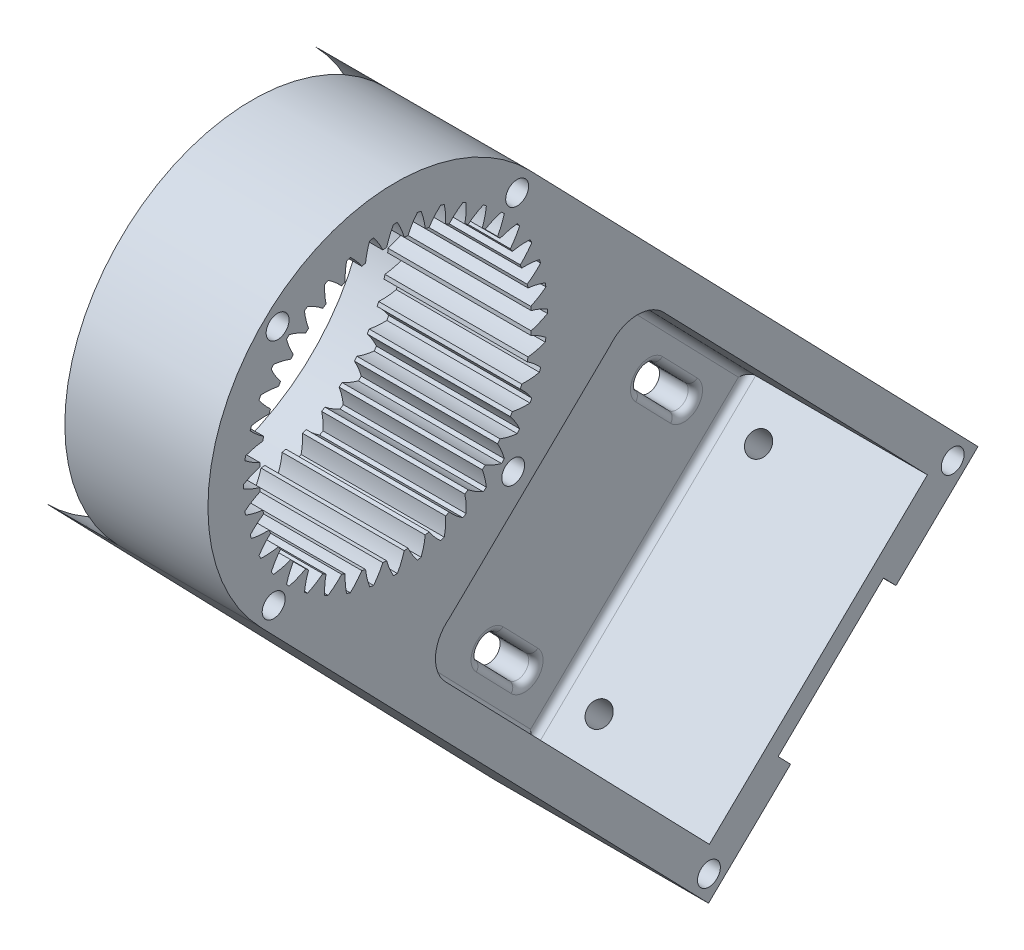
from build123d import *

# Parameters (mm, degrees)
BASPROSKE_W         = 30
BASPROSKE_H         = 7.2
TOOTHCUT_DEPTH      = 48.674731253
TEETHCUTS_COUNT     = 40
TEETHCUTS_ANGLE     = 351
BOSS_EXTRUDE1_START = -30
BOSS_EXTRUDE1_DEPTH = 30
BOSS_EXTRUDE2_START = -5
BOSS_EXTRUDE2_DEPTH = 5
CUT_EXTRUDE2_START  = -10
SKETCH5_R           = 26.2
CUT_EXTRUDE2_DEPTH  = 10
BOSS_EXTRUDE3_START = 25
BOSS_EXTRUDE3_DEPTH = 25
CUT_EXTRUDE3_DEPTH  = 25
FILLET1_R           = 5
CUT_EXTRUDE4_DEPTH  = 120.999510638
SKETCH9_R           = 1
CUT_EXTRUDE5_DEPTH  = 2
SKETCH11_R          = 1.6
CUT_EXTRUDE7_DEPTH  = 120.999510638
FILLET2_R           = 1
SKETCH1_R           = 1.6
CUT_EXTRUDE1_DEPTH  = 120.999510638
SKETCH12_R          = 1.6
CUT_EXTRUDE8_DEPTH  = 10
CUT_EXTRUDE9_DEPTH  = 119.848149137


with BuildPart() as part:
    # BasProSke → Base-Revolve (revolve)
    with BuildSketch(Plane(origin=(0, 0, 0), x_dir=(1, 0, 0), z_dir=(0, 1, 0)), mode=Mode.PRIVATE) as base_revolve_sk:
        with Locations((15, 22.6)):
            Rectangle(BASPROSKE_W, BASPROSKE_H)
    revolve(base_revolve_sk.sketch.rotate(Axis((-10, 0, 0), (1, 0, 0)), 180), axis=Axis((-10, 0, 0), (1, 0, 0)))

    # TooCutSke → ToothCut (cut, through all)
    with BuildSketch(Plane(origin=(0, 0, 0), x_dir=(0, 0, -1), z_dir=(1, 0, 0))):
        with BuildLine():
            ThreePointArc((1.228324582, 18.934800339), (0.823024268, 20.12207302), (0.272257981, 21.249255907))
            ThreePointArc((0.272257981, 21.249255907), (0, 21.251), (-0.272257981, 21.249255907))
            ThreePointArc((-0.272257981, 21.249255907), (-0.823024268, 20.12207302), (-1.228324582, 18.934800339))
            ThreePointArc((-1.228324582, 18.934800339), (0, 18.9746), (1.228324582, 18.934800339))
        make_face()
    toothcut = extrude(amount=TOOTHCUT_DEPTH, mode=Mode.SUBTRACT)

    # TeethCuts: ToothCut ×40 about axis
    teethcuts_axis = Axis((-10, 0, 0), (1, 0, 0))
    for i in range(1, TEETHCUTS_COUNT):
        add(toothcut.rotate(teethcuts_axis, i * TEETHCUTS_ANGLE / (TEETHCUTS_COUNT - 1)), mode=Mode.SUBTRACT)

    # Sketch3 → Boss-Extrude1 (add)
    with BuildSketch(Plane.ZY.offset(BOSS_EXTRUDE1_START)):
        with BuildLine():
            Line((-43.870748258, -75.827418835), (4.530431082, -25.80533267))
            ThreePointArc((4.530431082, -25.80533267), (12.28016055, -23.143847063), (18.828747548, -18.218624146))
            Line((18.828747548, -18.218624146), (-43.754312495, -82.897527937))
            Line((-43.754312495, -82.897527937), (-55.216851555, -71.806418963))
            Line((-55.216851555, -71.806418963), (-53.478433221, -70.009782747))
            Line((-53.478433221, -70.009782747), (-68.210850196, -55.754752404))
            Line((-68.210850196, -55.754752404), (-69.94926853, -57.55138862))
            Line((-69.94926853, -57.55138862), (-81.411807591, -46.460279646))
            Line((-81.411807591, -46.460279646), (-18.828747548, 18.218624146))
            ThreePointArc((-18.828747548, 18.218624146), (-23.535664136, 11.51140798), (-25.940519149, 3.678242283))
            Line((-25.940519149, 3.678242283), (-74.341698489, -46.343843882))
            Line((-74.341698489, -46.343843882), (-43.870748258, -75.827418835))
        make_face()
    extrude(amount=BOSS_EXTRUDE1_DEPTH)

    # Sketch4 → Boss-Extrude2 (add)
    with BuildSketch(Plane.ZY.offset(BOSS_EXTRUDE2_START)):
        with BuildLine():
            Line((4.530431082, -25.80533267), (-43.870748258, -75.827418835))
            Line((-43.870748258, -75.827418835), (-74.341698489, -46.343843882))
            Line((-74.341698489, -46.343843882), (-25.940519149, 3.678242283))
            ThreePointArc((-25.940519149, 3.678242283), (-18.218624146, -18.828747548), (4.530431082, -25.80533267))
        make_face()
    extrude(amount=BOSS_EXTRUDE2_DEPTH)

    # Sketch5 → Cut-Extrude2 (cut)
    with BuildSketch(Plane.ZY.offset(CUT_EXTRUDE2_START)):
        Circle(SKETCH5_R)
    extrude(amount=CUT_EXTRUDE2_DEPTH, mode=Mode.SUBTRACT)

    # Sketch6 → Boss-Extrude3 (add)
    with BuildSketch(Plane(origin=(5, 0, 0), x_dir=(0, 0, -1), z_dir=(1, 0, 0)).offset(BOSS_EXTRUDE3_START)):
        with BuildLine():
            Line((25.940519149, 3.678242283), (31.153160938, -1.708965638))
            ThreePointArc((31.153160938, -1.708965638), (21.695460815, -22.422019981), (0.682210708, -31.192540591))
            Line((0.682210708, -31.192540591), (-4.530431082, -25.80533267))
            ThreePointArc((-4.530431082, -25.80533267), (18.218624146, -18.828747548), (25.940519149, 3.678242283))
        make_face()
    extrude(amount=-BOSS_EXTRUDE3_DEPTH)

    # Sketch7 → Cut-Extrude3 (cut)
    with BuildSketch(Plane(origin=(30, 0, 0), x_dir=(0, 0, -1), z_dir=(1, 0, 0))):
        with BuildLine():
            Line((7.552294735, -30.272146343), (30.007043961, -8.545016836))
            ThreePointArc((30.007043961, -8.545016836), (21.695460815, -22.422019981), (7.552294735, -30.272146343))
        make_face()
    extrude(amount=-CUT_EXTRUDE3_DEPTH, mode=Mode.SUBTRACT)

    # Fillet1
    # the kernel refuses this fillet: 5 mm, written as the material it adds along each edge
    with BuildSketch(Plane(origin=(30, -1.708965638, -31.153160938), x_dir=(0, -0.7186544865731284, -0.6953673338087671), z_dir=(-1, 0, 0))) as fillet1_piece_1:
        with BuildLine():
            CenterArc((9.082355484, 5), FILLET1_R, 173.370663496, 96.629336504)
            Line((4.115786557, 5.577228804), (4.016455179, 5.58877338))
            ThreePointArc((4.016455179, 5.58877338), (2.132792747, 2.733341392), (-0.073368738, 0.067948718))
            Line((-0.073368738, 0.067948718), (0, -0.1))
            Line((0, -0.1), (9.082355484, -0.1))
            Line((9.082355484, -0.1), (9.082355484, 0))
        make_face()
    extrude(amount=25)
    with BuildSketch(Plane(origin=(30, -31.192540591, -0.682210708), x_dir=(0, -0.7186544865731269, -0.6953673338087686), z_dir=(-1, 0, 0))) as fillet1_piece_2:
        with BuildLine():
            CenterArc((9.082355484, -5), FILLET1_R, 90, 96.629336504)
            Line((4.115786557, -5.577228804), (4.016455179, -5.58877338))
            ThreePointArc((4.016455179, -5.58877338), (2.132792747, -2.733341392), (-0.073368738, -0.067948718))
            Line((-0.073368738, -0.067948718), (0, 0.1))
            Line((0, 0.1), (9.082355484, 0.1))
            Line((9.082355484, 0.1), (9.082355484, 0))
        make_face()
    extrude(amount=25)

    # Sketch8 → Cut-Extrude4 (cut, through all)
    with BuildSketch(Plane.ZY):
        with BuildLine():
            Line((-15.460756154, -40.713649318), (-20.32832749, -45.744230724))
            ThreePointArc((-20.32832749, -45.744230724), (-22.590762403, -45.781490168), (-22.628021847, -43.519055256))
            Line((-22.628021847, -43.519055256), (-17.760450511, -38.488473849))
            ThreePointArc((-17.760450511, -38.488473849), (-15.498015598, -38.451214405), (-15.460756154, -40.713649318))
        make_face()
        with BuildLine():
            Line((-40.038739594, -16.932086501), (-44.906310931, -21.962667907))
            ThreePointArc((-44.906310931, -21.962667907), (-44.869051487, -24.22510282), (-42.606616574, -24.187843376))
            Line((-42.606616574, -24.187843376), (-37.739045237, -19.15726197))
            ThreePointArc((-37.739045237, -19.15726197), (-37.776304682, -16.894827057), (-40.038739594, -16.932086501))
        make_face()
        with BuildLine():
            Line((-66.462698279, -44.240956991), (-61.595126943, -39.210375585))
            ThreePointArc((-61.595126943, -39.210375585), (-59.33269203, -39.173116141), (-59.295432586, -41.435551053))
            Line((-59.295432586, -41.435551053), (-64.163003922, -46.466132459))
            ThreePointArc((-64.163003922, -46.466132459), (-66.425438835, -46.503391904), (-66.462698279, -44.240956991))
        make_face()
        with BuildLine():
            Line((-41.884714838, -68.022519807), (-37.017143502, -62.991938401))
            ThreePointArc((-37.017143502, -62.991938401), (-37.054402946, -60.729503489), (-39.316837859, -60.766762933))
            Line((-39.316837859, -60.766762933), (-44.184409195, -65.797344339))
            ThreePointArc((-44.184409195, -65.797344339), (-44.147149751, -68.059779252), (-41.884714838, -68.022519807))
        make_face()
    extrude(amount=-CUT_EXTRUDE4_DEPTH, mode=Mode.SUBTRACT)

    # Sketch9 → Cut-Extrude5 (cut)
    with BuildSketch(Plane.ZY):
        with Locations((-60.586073704, -29.247549279)):
            Circle(SKETCH9_R)
        with Locations((-51.275119812, -31.133321699)):
            Circle(SKETCH9_R)
    extrude(amount=-CUT_EXTRUDE5_DEPTH, mode=Mode.SUBTRACT)

    # Sketch11 → Cut-Extrude7 (cut, through all)
    with BuildSketch(Plane(origin=(30, 0, 0), x_dir=(0, 0, -1), z_dir=(1, 0, 0))):
        with Locations((43.812530376, -79.362473386)):
            Circle(SKETCH11_R)
        with Locations((77.87675304, -46.402061764)):
            Circle(SKETCH11_R)
    extrude(amount=-CUT_EXTRUDE7_DEPTH, mode=Mode.SUBTRACT)

    # Fillet2
    fillet2_edges = [part.edges().sort_by_distance(p)[0] for p in [
        (5, -19.40858159, -18.779669348),
        (5, -27.289942519, -55.905216373),
        (5, -33.871525807, -5.604858434),
        (5, -6.717158932, -33.66859775),
        (5, -38.451214405, -15.498015598),
        (5, -43.228940021, -17.894541822),
        (5, -45.781490168, -22.590762403),
        (5, -41.003764553, -20.194236179),
        (5, -16.894827057, -37.776304682),
        (5, -21.672552673, -40.172830906),
        (5, -24.22510282, -44.869051487),
        (5, -19.447377204, -42.472525263),
        (5, -46.503391904, -66.425438835),
        (5, -41.725666288, -64.028912611),
        (5, -39.173116141, -59.33269203),
        (5, -43.950841756, -61.729218254),
        (5, -68.059779252, -44.147149751),
        (5, -63.282053636, -41.750623527),
        (5, -60.729503489, -37.054402946),
        (5, -65.507229104, -39.45092917),
        (5, -61.085631359, -59.106223374),
        (5, -56.773517472, -25.434266142),
    ]]
    fillet(fillet2_edges, radius=FILLET2_R)

    # Sketch1 → Cut-Extrude1 (cut, through all)
    with BuildSketch(Plane(origin=(30, 0, 0), x_dir=(0, 0, -1), z_dir=(1, 0, 0))):
        with Locations((16.461094787, -17.012360299)):
            Circle(SKETCH1_R)
        with Locations((-17.012360299, -16.461094787)):
            Circle(SKETCH1_R)
        with Locations((-16.461094787, 17.012360299)):
            Circle(SKETCH1_R)
        with Locations((17.012360299, 16.461094787)):
            Circle(SKETCH1_R)
    extrude(amount=-CUT_EXTRUDE1_DEPTH, mode=Mode.SUBTRACT)

    # Sketch12 → Cut-Extrude8 (cut)
    with BuildSketch(Plane(origin=(0, -64.678903792, -62.583060043), x_dir=(1, 0, 0), z_dir=(0, -0.7186544865731439, -0.6953673338087512))):
        with Locations(Location((10.5, 15.5, 0), (0, 0, 270))):
            Circle(SKETCH12_R)
        with Locations(Location((10.5, -15.5, 0), (0, 0, 270))):
            Circle(SKETCH12_R)
    extrude(amount=-CUT_EXTRUDE8_DEPTH, mode=Mode.SUBTRACT)

    # Sketch13 → Cut-Extrude9 (cut, through all)
    with BuildSketch(Plane(origin=(5, 0, 0), x_dir=(0, 0, -1), z_dir=(1, 0, 0))):
        with BuildLine():
            Line((19.84175768, -27.822998996), (17.761275763, -25.661611712))
            ThreePointArc((17.761275763, -25.661611712), (17.481920032, -24.949048161), (17.788244219, -24.247655311))
            Line((17.788244219, -24.247655311), (23.551943644, -18.699703533))
            ThreePointArc((23.551943644, -18.699703533), (24.264507194, -18.420347802), (24.965900044, -18.726671988))
            Line((24.965900044, -18.726671988), (27.046381961, -20.888059273))
            ThreePointArc((27.046381961, -20.888059273), (27.325737692, -21.600622823), (27.019413505, -22.302015673))
            Line((27.019413505, -22.302015673), (21.25571408, -27.849967452))
            ThreePointArc((21.25571408, -27.849967452), (20.54315053, -28.129323183), (19.84175768, -27.822998996))
        make_face()
    extrude(amount=-CUT_EXTRUDE9_DEPTH, mode=Mode.SUBTRACT)


solid = part.part
